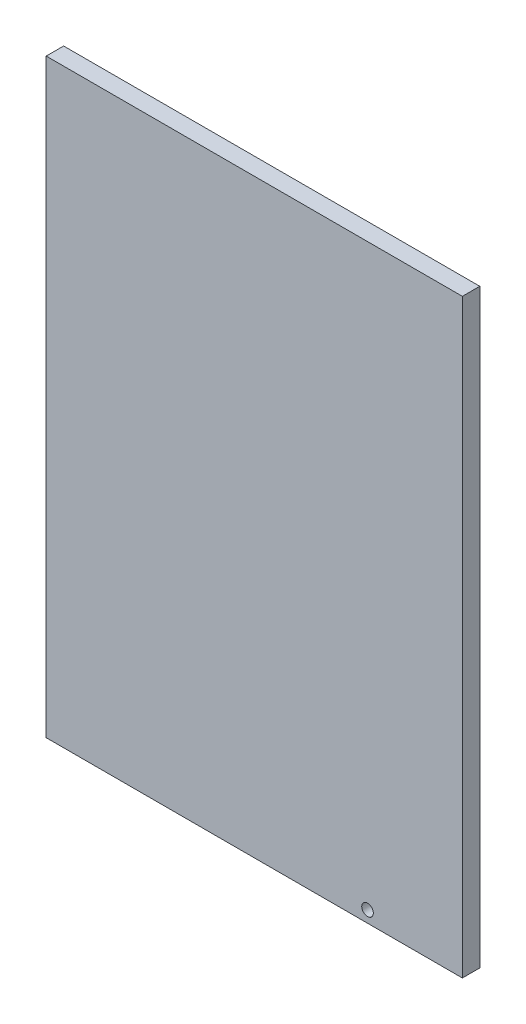
from build123d import *

# Parameters (mm, degrees)
SKETCH1_W           = 215
SKETCH1_H           = 305
BOSS_EXTRUDE1_DEPTH = 9
SKETCH2_R           = 3
CUT_EXTRUDE1_DEPTH  = 187.798019261


with BuildPart() as part:
    # Sketch1 → Boss-Extrude1 (new body)
    with BuildSketch(Plane.XY):
        Rectangle(SKETCH1_W, SKETCH1_H)
    extrude(amount=BOSS_EXTRUDE1_DEPTH)

    # Sketch2 → Cut-Extrude1 (cut, through all)
    with BuildSketch(Plane.XY.offset(9)):
        with Locations((58.5, -146.5)):
            Circle(SKETCH2_R)
    extrude(amount=-CUT_EXTRUDE1_DEPTH, mode=Mode.SUBTRACT)


solid = part.part
